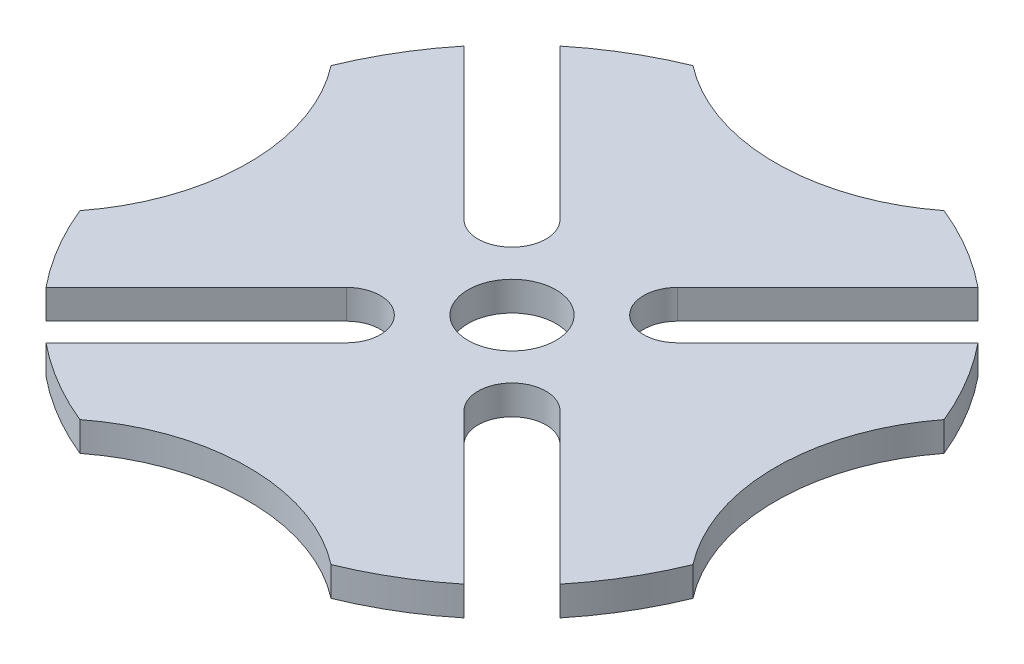
from build123d import *

# Parameters (mm, degrees)
SKETCH1_R           = 71.8312
SKETCH1_R_2         = 9.525
BOSS_EXTRUDE1_DEPTH = 6.35
CUT_EXTRUDE1_START  = -6.35
CUT_EXTRUDE1_DEPTH  = 6.35
CIRPATTERN1_COUNT   = 4


# Read off the part's stored shape, not the designer's step: Cut-Extrude1
with BuildPart() as part:
    # Sketch1 → Boss-Extrude1 (new body)
    with BuildSketch(Plane(origin=(0, 0, 0), x_dir=(1, 0, 0), z_dir=(0, 1, 0))):
        with Locations(Location((0, 0, 0), (0, 0, 270))):
            Circle(SKETCH1_R)
        with Locations(Location((0, 0, 0), (0, 0, 270))):
            Circle(SKETCH1_R_2, mode=Mode.SUBTRACT)
    extrude(amount=BOSS_EXTRUDE1_DEPTH)

    # Cut-Extrude1 outline → Cut-Extrude1 (cut)
    with BuildSketch(Plane(origin=(0, 6.35, 0), x_dir=(1, 0, 0), z_dir=(0, 1, 0)).offset(CUT_EXTRUDE1_START)):
        with BuildLine():
            ThreePointArc((-12.751963692, -23.169060792), (-12.751963692, -12.751963692), (-23.169060792, -12.751963692))
            Line((-23.169060792, -12.751963692), (-55.733113553, -45.316016453))
            ThreePointArc((-55.733113553, -45.316016453), (-50.792328621, -50.792328621), (-45.316016453, -55.733113553))
            Line((-45.316016453, -55.733113553), (-12.751963692, -23.169060792))
        make_face()
        with BuildLine():
            ThreePointArc((-66.4688917, 27.232475642), (-71.8312, 0), (-66.4688917, -27.232475642))
            ThreePointArc((-66.4688917, -27.232475642), (-57.15, 0), (-66.4688917, 27.232475642))
        make_face()
    cut_extrude1 = extrude(amount=CUT_EXTRUDE1_DEPTH, mode=Mode.SUBTRACT)

    # CirPattern1: Cut-Extrude1 ×4 about axis
    cirpattern1_axis = Axis((0, 0, 0), (0, 1, 0))
    for i in range(1, CIRPATTERN1_COUNT):
        add(cut_extrude1.rotate(cirpattern1_axis, i * 360 / CIRPATTERN1_COUNT), mode=Mode.SUBTRACT)


solid = part.part
